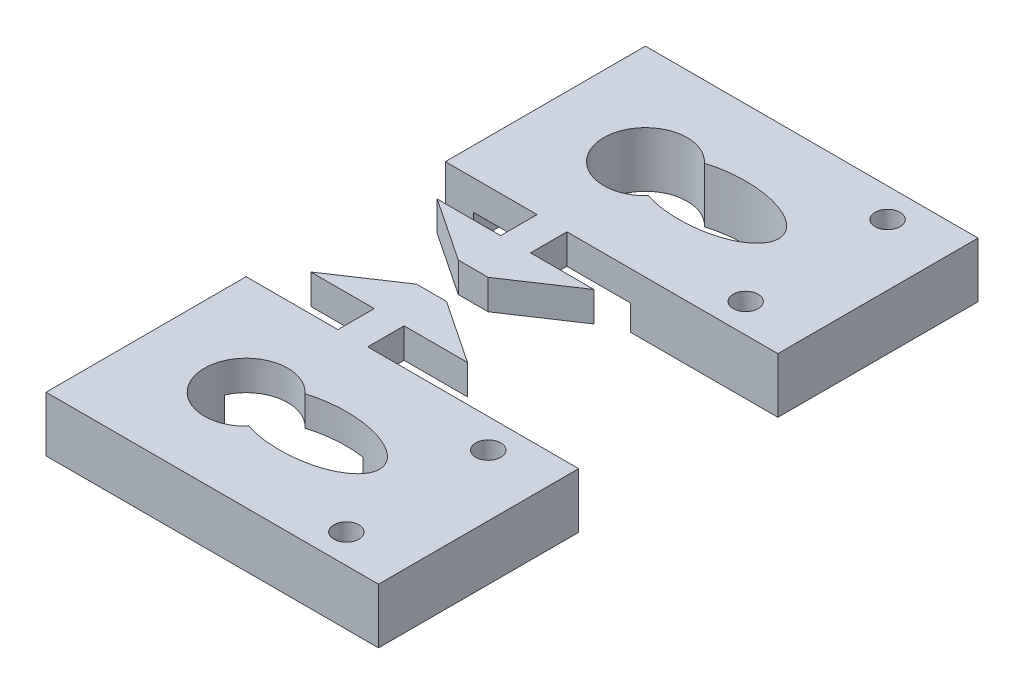
from build123d import *

# Parameters (mm, degrees)
BOSS_EXTRUDE1_DEPTH      = 3.5814
BOSS_EXTRUDE2_DEPTH      = 3.035
BOSS_EXTRUDE2_DEPTH_BACK = 3.035
SKETCH7_W                = 39.878
SKETCH7_H                = 24
CUT_EXTRUDE3_DEPTH       = 39.249964696
CUT_EXTRUDE3_DEPTH_BACK  = 39.249964696
SKETCH5_R                = 1.5
SKETCH8_W                = 18.796
SKETCH8_H                = 3.035
CUT_EXTRUDE4_DEPTH       = 10


with BuildPart() as part:
    # Sketch1 → Boss-Extrude1 (new body)
    with BuildSketch(Plane(origin=(0, 0, 0), x_dir=(1, 0, 0), z_dir=(0, 1, 0))):
        Polygon((-9.398, 2.1825), (-1.7907, 2.1825), (-1.7907, -2.1825), (-12.79, -2.1825), (-12.79, -26.1825), (27.088, -26.1825), (27.088, -2.1825), (1.7907, -2.1825), (1.7907, 2.1825), (9.398, 2.1825), (1.7907, 7.2625), (-1.7907, 7.2625), align=None)
    extrude(amount=BOSS_EXTRUDE1_DEPTH)

    # Sketch7 → Boss-Extrude2 (add, two sides: drawn at the far end of the back side and taken through both)
    with BuildSketch(Plane(origin=(0, 0, 0), x_dir=(1, 0, 0), z_dir=(0, 1, 0)).offset(-BOSS_EXTRUDE2_DEPTH_BACK)):
        with Locations((7.149, -14.1825)):
            Rectangle(SKETCH7_W, SKETCH7_H)
    extrude(amount=BOSS_EXTRUDE2_DEPTH + BOSS_EXTRUDE2_DEPTH_BACK)

    # Sketch5 → Cut-Extrude3 (cut, two sides: drawn at the far end of the back side and taken through both)
    with BuildSketch(Plane(origin=(0, 3.5814, 0), x_dir=(1, 0, 0), z_dir=(0, 1, 0)).offset(-CUT_EXTRUDE3_DEPTH_BACK)):
        with BuildLine():
            ThreePointArc((2.902928009, -10.811701472), (-5.79, -14.1825), (2.902928009, -17.553298528))
            add(Edge.make_bspline(
                [(2.902928009, -17.553298528), (15.21, -21.484670028), (15.21, -14.1825)],
                knots=[1.002278043, 1.002278043, 1.002278043, 3.141592654, 3.141592654, 3.141592654], degree=2, weights=[1, 0.480424813, 1]))
            add(Edge.make_bspline(
                [(15.21, -14.1825), (15.21, -6.880329972), (2.902928009, -10.811701472)],
                knots=[3.141592654, 3.141592654, 3.141592654, 5.280907265, 5.280907265, 5.280907265], degree=2, weights=[1, 0.480424813, 1]))
        make_face()
        with Locations((19.738, -22.6915)):
            Circle(SKETCH5_R)
        with Locations((19.738, -5.6735)):
            Circle(SKETCH5_R)
    extrude(amount=CUT_EXTRUDE3_DEPTH + CUT_EXTRUDE3_DEPTH_BACK, mode=Mode.SUBTRACT)

    # Sketch8 → Cut-Extrude4 (cut)
    with BuildSketch(Plane(origin=(0, 0, 2.1825), x_dir=(-1, 0, 0), z_dir=(0, 0, -1))):
        with Locations((0, -1.5175)):
            Rectangle(SKETCH8_W, SKETCH8_H)
    extrude(amount=-CUT_EXTRUDE4_DEPTH, mode=Mode.SUBTRACT)


with BuildPart() as body_2:
    # Mirror2: mirrored copy
    add(part.part.mirror(Plane(origin=(0, 0, -9.7625), x_dir=(1, 0, 0), z_dir=(0, 0, -1))))


solid = Compound([part.part, body_2.part])
